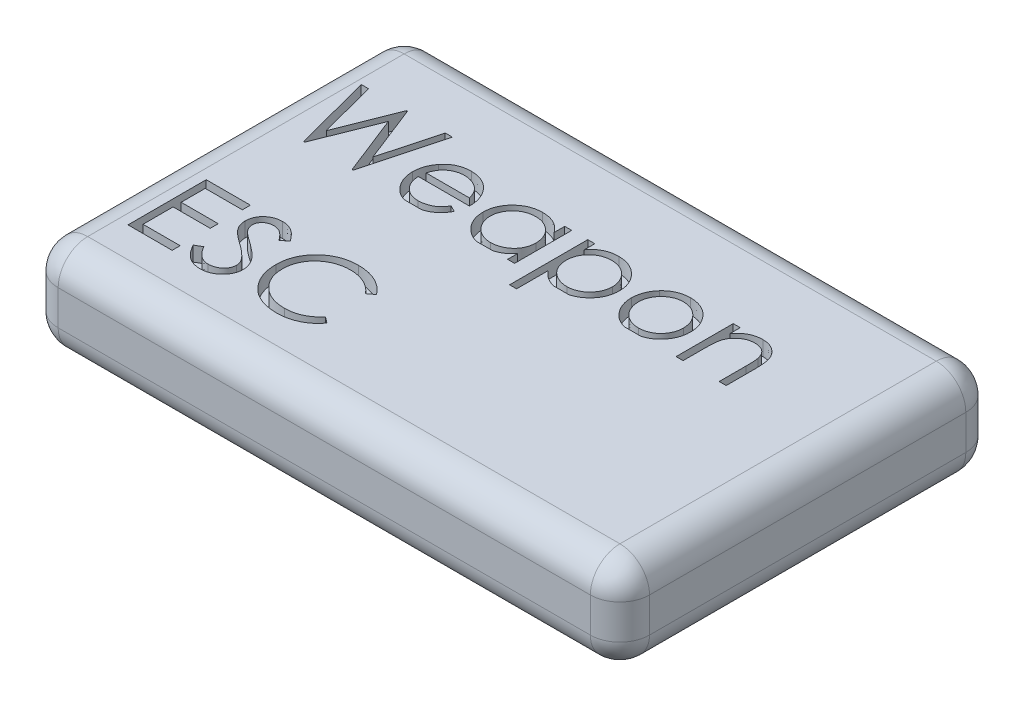
from build123d import *

# Parameters (mm, degrees)
SKETCH1_W           = 20
SKETCH1_H           = 12.7
BOSS_EXTRUDE1_DEPTH = 3.175
FILLET1_R           = 1
CUT_EXTRUDE1_DEPTH  = 0.5


with BuildPart() as part:
    # Sketch1 → Boss-Extrude1 (new body)
    with BuildSketch(Plane(origin=(0, 0, 0), x_dir=(1, 0, 0), z_dir=(0, 1, 0))):
        with Locations((10, 6.35)):
            Rectangle(SKETCH1_W, SKETCH1_H)
    extrude(amount=BOSS_EXTRUDE1_DEPTH)

    # Fillet1
    fillet1_edges = [part.edges().sort_by_distance(p)[0] for p in [
        (0, 0, -6.35),
        (10, 0, 0),
        (20, 0, -6.35),
        (10, 0, -12.7),
        (20, 3.175, -6.35),
        (10, 3.175, -12.7),
        (0, 1.5875, -12.7),
        (20, 1.5875, -12.7),
        (20, 1.5875, 0),
        (0, 1.5875, 0),
        (0, 3.175, -6.35),
        (10, 3.175, 0),
    ]]
    fillet(fillet1_edges, radius=FILLET1_R)

    # Sketch2 → Cut-Extrude1 (cut)
    # profile 1 of 9: a face of its own
    with BuildSketch(Plane(origin=(0, 3.175, 0), x_dir=(1, 0, 0), z_dir=(0, 1, 0))):
        Polygon((1.169604701, 10.078154517), (1.873464209, 7.432321183), (1.90738515, 7.432321183), (2.713007479, 9.45591727), (3.509089543, 7.432321183), (3.543010483, 7.432321183), (4.256410256, 10.078154517), (4.013663528, 10.078154517), (3.493189103, 8.151021103), (2.737388154, 10.078154517), (2.7029372, 10.078154517), (1.932825855, 8.137770736), (1.415001502, 10.078154517), align=None)
    # profile 2 of 9: a face of its own
    with BuildSketch(Plane(origin=(0, 3.175, 0), x_dir=(1, 0, 0), z_dir=(0, 1, 0))):
        with BuildLine():
            Line((14.466613248, 9.365814773), (14.466613248, 7.432321183))
            Line((14.466613248, 7.432321183), (14.704059829, 7.432321183))
            Line((14.704059829, 7.432321183), (14.704059829, 8.13141056))
            add(Edge.make_bspline(
                [(14.740630843, 8.650294941), (14.733558671, 8.622024009), (14.725668191, 8.575551441), (14.717826942, 8.508343896), (14.712486754, 8.447197589), (14.70923674, 8.378587746), (14.704283581, 8.272633885), (14.704413929, 8.18934941), (14.704059829, 8.13141056)],
                knots=[0, 0, 0, 0, 0.167615077, 0.271052394, 0.389459503, 0.520842802, 0.666398759, 1, 1, 1, 1], degree=3))
            add(Edge.make_bspline(
                [(15.398379073, 9.162289132), (15.360600247, 9.162469918), (15.304105063, 9.15816489), (15.231051749, 9.142372411), (15.177817866, 9.126614736), (15.12678507, 9.104942559), (15.076314475, 9.080353222), (15.028306384, 9.049700341), (14.981737126, 9.015538489), (14.938411467, 8.977680942), (14.898097439, 8.937733104), (14.862162217, 8.895191102), (14.829599732, 8.850742332), (14.80151176, 8.803769233), (14.768611554, 8.738203917), (14.750147755, 8.686018868), (14.740630843, 8.650294941)],
                knots=[0, 0, 0, 0, 0.126626858, 0.188984372, 0.250230194, 0.312351163, 0.374573618, 0.438147531, 0.502920413, 0.567974095, 0.630771334, 0.692934609, 0.754397534, 0.815218352, 0.876116925, 1, 1, 1, 1], degree=3))
            add(Edge.make_bspline(
                [(15.897122897, 8.781738584), (15.883876871, 8.839800748), (15.853883712, 8.922670919), (15.787158805, 9.014577688), (15.728309366, 9.069154339), (15.659336716, 9.111578994), (15.550161552, 9.152569693), (15.460103618, 9.162639998), (15.398379073, 9.162289132)],
                knots=[0, 0, 0, 0, 0.260833163, 0.378476029, 0.493177646, 0.609280965, 0.729981038, 1, 1, 1, 1], degree=3))
            add(Edge.make_bspline(
                [(15.925213675, 8.341826392), (15.924839802, 8.392175125), (15.924755613, 8.464286329), (15.921782966, 8.555978029), (15.918801593, 8.614487716), (15.914418668, 8.666066083), (15.90886111, 8.721247984), (15.902461912, 8.759017736), (15.897122897, 8.781738584)],
                knots=[0, 0, 0, 0, 0.342109649, 0.489825663, 0.623254428, 0.740079676, 0.841482673, 1, 1, 1, 1], degree=3))
            Line((15.925213675, 8.341826392), (15.925213675, 7.432321183))
            Line((15.925213675, 7.432321183), (16.162660256, 7.432321183))
            Line((16.162660256, 7.432321183), (16.162660256, 8.419738551))
            add(Edge.make_bspline(
                [(15.439720219, 9.399735713), (15.509551808, 9.39927324), (15.613779605, 9.387932084), (15.742723763, 9.340494706), (15.830878741, 9.292750656), (15.910350927, 9.233316994), (15.980143852, 9.164091415), (16.037870896, 9.084461584), (16.076573667, 9.010587722), (16.102068609, 8.945055094), (16.118119402, 8.888928093), (16.13174929, 8.826397107), (16.143569038, 8.757651109), (16.151552625, 8.682208429), (16.160346443, 8.569022266), (16.163249863, 8.480733856), (16.162660256, 8.419738551)],
                knots=[0, 0, 0, 0, 0.15117814, 0.223487984, 0.295542644, 0.366976255, 0.437130525, 0.507043616, 0.578559734, 0.616613545, 0.658756237, 0.704491226, 0.754803115, 0.809331625, 0.868274455, 1, 1, 1, 1], degree=3))
            add(Edge.make_bspline(
                [(14.704059829, 9.017065107), (14.751954556, 9.079209882), (14.828226204, 9.166084386), (14.947151906, 9.257222624), (15.037845438, 9.310241677), (15.132814589, 9.350149343), (15.26548569, 9.389149379), (15.369832665, 9.399375698), (15.439720219, 9.399735713)],
                knots=[0, 0, 0, 0, 0.273568781, 0.398988314, 0.519929781, 0.638110022, 0.756588901, 1, 1, 1, 1], degree=3))
            Line((14.704059829, 9.017065107), (14.704059829, 9.365814773))
            Line((14.704059829, 9.365814773), (14.466613248, 9.365814773))
        make_face()
    # profile 3 of 9: a face of its own
    with BuildSketch(Plane(origin=(0, 3.175, 0), x_dir=(1, 0, 0), z_dir=(0, 1, 0))):
        with BuildLine():
            add(Edge.make_bspline(
                [(12.712144434, 7.432321183), (12.702602512, 7.434820118), (12.661487393, 7.446283654), (12.590573573, 7.471506899), (12.502017329, 7.513314324), (12.419024046, 7.565179521), (12.341009816, 7.626079698), (12.269139873, 7.695729931), (12.20412923, 7.771332736), (12.146772097, 7.850821146), (12.09847678, 7.933529974), (12.0588865, 8.019619842), (12.028056775, 8.1087155), (11.998853126, 8.232985597), (11.990001418, 8.329082939), (11.990384615, 8.393767831)],
                knots=[0.179537829, 0.179537829, 0.179537829, 0.179537829, 0.198324187, 0.260825013, 0.322713588, 0.384554535, 0.446912858, 0.510957633, 0.574930701, 0.636684538, 0.697483115, 0.757133808, 0.816965664, 0.876818352, 1, 1, 1, 1], degree=3))
            Line((12.712144434, 7.432321183), (13.270991006, 7.432321183))
            add(Edge.make_bspline(
                [(13.991720085, 8.393767831), (13.992103285, 8.329082936), (13.983251572, 8.232985601), (13.95404793, 8.108715493), (13.923218185, 8.019619865), (13.883627978, 7.933529889), (13.835332387, 7.850821472), (13.777976305, 7.771331479), (13.712961587, 7.69573481), (13.641106845, 7.626061693), (13.56315594, 7.565336794), (13.480640762, 7.513313024), (13.392463653, 7.471398151), (13.321669585, 7.446276017), (13.280542351, 7.434820827), (13.270991006, 7.432321183)],
                knots=[0, 0, 0, 0, 0.123336979, 0.18326514, 0.243172443, 0.302898354, 0.363773598, 0.425605305, 0.489659043, 0.553784577, 0.616221533, 0.677854471, 0.739516897, 0.802096536, 0.820924402, 0.820924402, 0.820924402, 0.820924402], degree=3))
            add(Edge.make_bspline(
                [(13.72671274, 9.081196884), (13.769825468, 9.034072385), (13.827575742, 8.958523683), (13.889744812, 8.8493938), (13.926865155, 8.764561953), (13.956076795, 8.676583307), (13.984192162, 8.553408955), (13.99136147, 8.457976043), (13.991720085, 8.393767831)],
                knots=[0, 0, 0, 0, 0.253834363, 0.376505623, 0.498533686, 0.621367729, 0.744564745, 1, 1, 1, 1], degree=3))
            add(Edge.make_bspline(
                [(12.99211238, 9.399735713), (13.063240061, 9.400472495), (13.168488418, 9.390217486), (13.303142533, 9.356468769), (13.398238253, 9.322295252), (13.487727627, 9.276387615), (13.602907554, 9.202647234), (13.679723886, 9.132553723), (13.72671274, 9.081196884)],
                knots=[0, 0, 0, 0, 0.258332351, 0.382133976, 0.503804392, 0.624692987, 0.74687059, 1, 1, 1, 1], degree=3))
            add(Edge.make_bspline(
                [(12.25539196, 9.07960684), (12.301972755, 9.131650244), (12.379473347, 9.201077753), (12.494379792, 9.276310446), (12.584853185, 9.32131333), (12.679872378, 9.356670471), (12.815073419, 9.390194033), (12.920623999, 9.400388369), (12.99211238, 9.399735713)],
                knots=[0, 0, 0, 0, 0.252712986, 0.374819133, 0.496436426, 0.617910557, 0.741287617, 1, 1, 1, 1], degree=3))
            add(Edge.make_bspline(
                [(11.990384615, 8.393767831), (11.990758258, 8.457802136), (11.9979758, 8.553046326), (12.025955779, 8.675896819), (12.055204118, 8.763534905), (12.092660312, 8.847998769), (12.154009835, 8.957425104), (12.212746192, 9.032351578), (12.25539196, 9.07960684)],
                knots=[0, 0, 0, 0, 0.255237725, 0.378678596, 0.501087887, 0.622713679, 0.746240795, 1, 1, 1, 1], degree=3))
        make_face()
        with BuildLine():
            add(Edge.make_bspline(
                [(12.99105235, 9.162289132), (12.940416909, 9.162154053), (12.865162406, 9.155316907), (12.768426838, 9.131803729), (12.699302166, 9.107182404), (12.633055593, 9.075350674), (12.569624097, 9.036263511), (12.508821007, 8.990427359), (12.45183572, 8.937917033), (12.399537326, 8.88055609), (12.35381835, 8.819438581), (12.314945247, 8.755555841), (12.2825534, 8.688841236), (12.258458396, 8.618619509), (12.234691255, 8.520201636), (12.227973222, 8.443678193), (12.227831197, 8.392177787)],
                knots=[0, 0, 0, 0, 0.126043628, 0.187165358, 0.24739929, 0.308380031, 0.369779617, 0.432583925, 0.497640786, 0.562401137, 0.625557103, 0.687332005, 0.748312746, 0.809791039, 0.871767572, 1, 1, 1, 1], degree=3))
            add(Edge.make_bspline(
                [(13.754273504, 8.392177787), (13.754135216, 8.443680536), (13.747406275, 8.520197138), (13.72365664, 8.618625991), (13.699512994, 8.68881721), (13.667261841, 8.755728574), (13.627639081, 8.819251014), (13.582106787, 8.880767808), (13.529177317, 8.937731606), (13.472251516, 8.990447837), (13.411423773, 9.036281257), (13.34808637, 9.075178987), (13.282032129, 9.107454217), (13.212899063, 9.13158079), (13.116466481, 9.155479429), (13.04148293, 9.162024198), (12.99105235, 9.162289132)],
                knots=[0, 0, 0, 0, 0.128273727, 0.19027022, 0.251768314, 0.312768695, 0.374793279, 0.437969586, 0.5030474, 0.568125214, 0.630949749, 0.692369109, 0.752973168, 0.813641067, 0.874355209, 1, 1, 1, 1], degree=3))
            add(Edge.make_bspline(
                [(12.99105235, 7.635846824), (13.058532582, 7.635171522), (13.158767738, 7.647549464), (13.285779483, 7.688593328), (13.375156687, 7.730814506), (13.457983625, 7.784510739), (13.533087708, 7.848336868), (13.597906216, 7.923489909), (13.653355783, 8.007066309), (13.698322034, 8.097237972), (13.742211068, 8.224400191), (13.754155656, 8.325108514), (13.754273504, 8.392177787)],
                knots=[0, 0, 0, 0, 0.168983264, 0.250907582, 0.333708096, 0.416004984, 0.497659568, 0.579893286, 0.663902321, 0.748466254, 0.831790886, 1, 1, 1, 1], degree=3))
            add(Edge.make_bspline(
                [(12.227831197, 8.392177787), (12.227996992, 8.32513087), (12.239799272, 8.224356193), (12.283897829, 8.09737784), (12.328139757, 8.006955577), (12.383643984, 7.923292332), (12.449020773, 7.848700482), (12.523588586, 7.784307904), (12.606453109, 7.73086193), (12.69592376, 7.688462797), (12.823225603, 7.647737473), (12.923542682, 7.635085143), (12.99105235, 7.635846824)],
                knots=[0, 0, 0, 0, 0.168178654, 0.251488198, 0.335840671, 0.419834494, 0.502344876, 0.58364902, 0.665931005, 0.748716525, 0.831047336, 1, 1, 1, 1], degree=3))
        make_face(mode=Mode.SUBTRACT)
    # profile 4 of 9: a face of its own
    with BuildSketch(Plane(origin=(0, 3.175, 0), x_dir=(1, 0, 0), z_dir=(0, 1, 0))):
        with BuildLine():
            Line((9.548076923, 9.365814773), (9.548076923, 6.71998144))
            Line((9.548076923, 6.71998144), (9.785523504, 6.71998144))
            Line((9.785523504, 6.71998144), (9.785523504, 7.782660893))
            add(Edge.make_bspline(
                [(10.309139651, 7.432321183), (10.286824521, 7.438215017), (10.229663629, 7.455480196), (10.140646746, 7.493035323), (10.043784805, 7.547692184), (9.919004992, 7.638028574), (9.836581533, 7.722079417), (9.785523504, 7.782660893)],
                knots=[0.295016817, 0.295016817, 0.295016817, 0.295016817, 0.371230204, 0.49211577, 0.613400988, 0.73799732, 1, 1, 1, 1], degree=3))
            Line((10.309139651, 7.432321183), (10.84371721, 7.432321183))
            add(Edge.make_bspline(
                [(11.583333333, 8.404368125), (11.583179694, 8.336703394), (11.574470508, 8.236398186), (11.543737741, 8.107341464), (11.511220598, 8.015662082), (11.469149491, 7.927983843), (11.417970446, 7.844370705), (11.357579428, 7.764849278), (11.288560303, 7.690499124), (11.213680956, 7.622010533), (11.133642613, 7.562109693), (11.049687408, 7.51180988), (10.962244546, 7.469783372), (10.892613281, 7.445754471), (10.852665682, 7.434671204), (10.84371721, 7.432321183)],
                knots=[0, 0, 0, 0, 0.128034164, 0.189573725, 0.250579835, 0.311733221, 0.37325008, 0.435762516, 0.500345561, 0.564949367, 0.627527909, 0.68915729, 0.749865012, 0.8107602, 0.828257924, 0.828257924, 0.828257924, 0.828257924], degree=3))
            add(Edge.make_bspline(
                [(10.566765158, 9.399735713), (10.634523234, 9.399056776), (10.735279303, 9.391527687), (10.864875314, 9.360709005), (10.956773692, 9.327925237), (11.045419327, 9.287357516), (11.129497848, 9.236168489), (11.210319419, 9.176896638), (11.285851338, 9.108685566), (11.355641732, 9.034883215), (11.416002238, 8.955491339), (11.46806397, 8.8731209), (11.51015594, 8.786494406), (11.543092323, 8.696295982), (11.574822845, 8.569488388), (11.582945473, 8.47075633), (11.583333333, 8.404368125)],
                knots=[0, 0, 0, 0, 0.128636051, 0.190652902, 0.252125037, 0.313446276, 0.375227279, 0.438498083, 0.5032851, 0.568009687, 0.630878982, 0.692153504, 0.75255215, 0.813191094, 0.8739854, 1, 1, 1, 1], degree=3))
            add(Edge.make_bspline(
                [(9.785523504, 9.008054857), (9.832517462, 9.072544737), (9.911459824, 9.160185002), (10.033378372, 9.254052547), (10.129471841, 9.308049897), (10.231096944, 9.348692737), (10.375661619, 9.389626955), (10.48986918, 9.399492715), (10.566765158, 9.399735713)],
                knots=[0, 0, 0, 0, 0.263044683, 0.386061082, 0.505770653, 0.625178031, 0.746147722, 1, 1, 1, 1], degree=3))
            Line((9.785523504, 9.008054857), (9.785523504, 9.365814773))
            Line((9.785523504, 9.365814773), (9.548076923, 9.365814773))
        make_face()
        with BuildLine():
            add(Edge.make_bspline(
                [(10.564645099, 9.162289132), (10.511648566, 9.163069991), (10.43346287, 9.15545716), (10.332421594, 9.133073397), (10.261269021, 9.10822714), (10.193044081, 9.077678682), (10.128270869, 9.039519066), (10.066995234, 8.994424335), (10.009371188, 8.943262153), (9.957313952, 8.886887194), (9.911228399, 8.826722605), (9.872519882, 8.76284455), (9.840383836, 8.695847886), (9.81595846, 8.625208117), (9.792362764, 8.525292938), (9.785672459, 8.447387225), (9.785523504, 8.394827861)],
                knots=[0, 0, 0, 0, 0.130023749, 0.192374057, 0.253884304, 0.314896085, 0.375805828, 0.438242236, 0.501591268, 0.56488076, 0.626533341, 0.687515765, 0.748105916, 0.808795537, 0.870821519, 1, 1, 1, 1], degree=3))
            add(Edge.make_bspline(
                [(11.345886752, 8.401718052), (11.346817733, 8.467879241), (11.331999718, 8.566849059), (11.288531545, 8.693418546), (11.241308701, 8.783772985), (11.185197526, 8.869023909), (11.117357889, 8.944282916), (11.041295685, 9.010176639), (10.956107869, 9.064628588), (10.864684532, 9.107889783), (10.735396255, 9.150638224), (10.633059866, 9.16199055), (10.564645099, 9.162289132)],
                knots=[0, 0, 0, 0, 0.163349297, 0.245826474, 0.33036716, 0.415198374, 0.497940932, 0.580476126, 0.663740011, 0.747512837, 0.830398741, 1, 1, 1, 1], degree=3))
            add(Edge.make_bspline(
                [(10.568355202, 7.635846824), (10.635242483, 7.635441413), (10.735159151, 7.648970077), (10.862858048, 7.690494395), (10.953709978, 7.735459991), (11.038998553, 7.790652791), (11.116017129, 7.856839866), (11.1832988, 7.933562349), (11.240661225, 8.018991891), (11.286827072, 8.110591808), (11.3331314, 8.236400124), (11.345127243, 8.3360851), (11.345886752, 8.401718052)],
                knots=[0, 0, 0, 0, 0.165573796, 0.248158777, 0.332033307, 0.416257349, 0.49952535, 0.58303856, 0.668595904, 0.75403535, 0.8369197, 1, 1, 1, 1], degree=3))
            add(Edge.make_bspline(
                [(9.785523504, 8.394827861), (9.7856499, 8.326204868), (9.797088246, 8.224081286), (9.839442573, 8.095694713), (9.883643571, 8.006901208), (9.939556109, 7.925271164), (10.006906936, 7.85217688), (10.0851054, 7.788082641), (10.17284659, 7.734078241), (10.266903258, 7.69029228), (10.397797879, 7.648179527), (10.500220186, 7.635975007), (10.568355202, 7.635846824)],
                knots=[0, 0, 0, 0, 0.169344011, 0.251060671, 0.332326431, 0.413189279, 0.494299499, 0.57665388, 0.661784919, 0.74776493, 0.831967435, 1, 1, 1, 1], degree=3))
        make_face(mode=Mode.SUBTRACT)
    # profile 5 of 9: a face of its own
    with BuildSketch(Plane(origin=(0, 3.175, 0), x_dir=(1, 0, 0), z_dir=(0, 1, 0))):
        with BuildLine():
            add(Edge.make_bspline(
                [(7.709182374, 7.432321183), (7.700230275, 7.434671071), (7.660278507, 7.445750285), (7.590644343, 7.46978449), (7.503201536, 7.511809687), (7.419245436, 7.562109321), (7.339210722, 7.62201227), (7.264317311, 7.690492324), (7.195350443, 7.764874295), (7.134827282, 7.844208129), (7.0843675, 7.92815079), (7.042161408, 8.015639674), (7.009690951, 8.107347486), (6.978941396, 8.236393985), (6.970242702, 8.336705582), (6.97008547, 8.404368125)],
                knots=[0.171490765, 0.171490765, 0.171490765, 0.171490765, 0.189004127, 0.249930071, 0.310668454, 0.372328961, 0.43493911, 0.499575544, 0.564191208, 0.626735217, 0.688109334, 0.749293607, 0.810330528, 0.87190117, 1, 1, 1, 1], degree=3))
            Line((7.709182374, 7.432321183), (8.254199087, 7.432321183))
            add(Edge.make_bspline(
                [(8.767895299, 7.766760453), (8.717066909, 7.706699131), (8.635037797, 7.623144112), (8.509075274, 7.53648614), (8.411809694, 7.484936906), (8.325920279, 7.452393426), (8.272752076, 7.437107324), (8.254199087, 7.432321183)],
                knots=[0, 0, 0, 0, 0.262084975, 0.386269912, 0.507164597, 0.627300236, 0.69099225, 0.69099225, 0.69099225, 0.69099225], degree=3))
            Line((8.767895299, 7.766760453), (8.767895299, 7.432321183))
            Line((8.767895299, 7.432321183), (9.00534188, 7.432321183))
            Line((9.00534188, 7.432321183), (9.00534188, 9.365814773))
            Line((9.00534188, 9.365814773), (8.767895299, 9.365814773))
            Line((8.767895299, 9.365814773), (8.767895299, 9.008054857))
            add(Edge.make_bspline(
                [(7.985593616, 9.399735713), (8.062846419, 9.399509706), (8.177557151, 9.389591562), (8.322698327, 9.348786058), (8.4244972, 9.308069228), (8.520606377, 9.253874385), (8.643012455, 9.160775719), (8.721079203, 9.072278963), (8.767895299, 9.008054857)],
                knots=[0, 0, 0, 0, 0.254653531, 0.376014554, 0.495255252, 0.614797719, 0.738105554, 1, 1, 1, 1], degree=3))
            add(Edge.make_bspline(
                [(6.97008547, 8.404368125), (6.970476792, 8.470754173), (6.978589276, 8.569492553), (7.010336124, 8.69628997), (7.043226831, 8.786516867), (7.085448545, 8.872952839), (7.136796807, 8.955656982), (7.197288049, 9.034857673), (7.267026312, 9.108692502), (7.342572277, 9.176894846), (7.423390199, 9.236168877), (7.507469623, 9.287357685), (7.596115181, 9.327924187), (7.688012971, 9.360713066), (7.81744157, 9.391464819), (7.918001471, 9.399132749), (7.985593616, 9.399735713)],
                knots=[0, 0, 0, 0, 0.12607881, 0.186904093, 0.247573935, 0.308003356, 0.369131898, 0.432033228, 0.496790794, 0.561610823, 0.624913866, 0.686726349, 0.748078833, 0.809582291, 0.871630743, 1, 1, 1, 1], degree=3))
        make_face()
        with BuildLine():
            add(Edge.make_bspline(
                [(7.988773705, 9.162289132), (7.92035925, 9.161990351), (7.818021942, 9.15063861), (7.688735162, 9.107889216), (7.597307561, 9.064630734), (7.512135574, 9.010168714), (7.436014824, 8.94431224), (7.36832955, 8.868839239), (7.311381807, 8.784096131), (7.265041097, 8.693245235), (7.221301324, 8.566912736), (7.206660007, 8.467847372), (7.207532051, 8.401718052)],
                knots=[0, 0, 0, 0, 0.169593435, 0.252475515, 0.336244477, 0.419504521, 0.502035907, 0.584774648, 0.669846475, 0.754184866, 0.836658238, 1, 1, 1, 1], degree=3))
            add(Edge.make_bspline(
                [(8.767895299, 8.394827861), (8.767746516, 8.44738738), (8.761055711, 8.525292642), (8.737460812, 8.625208537), (8.713033256, 8.695846346), (8.680905325, 8.762850307), (8.642166221, 8.826700861), (8.596124118, 8.887066082), (8.543523048, 8.943114758), (8.485945742, 8.994236966), (8.425020131, 9.039870107), (8.360024236, 9.077354483), (8.292051441, 9.108388518), (8.220982581, 9.133043936), (8.119966187, 9.155477809), (8.041764877, 9.163059196), (7.988773705, 9.162289132)],
                knots=[0, 0, 0, 0, 0.129188088, 0.191218683, 0.251912818, 0.312507474, 0.373494434, 0.4351516, 0.498741474, 0.562095217, 0.624186567, 0.685475718, 0.746096815, 0.807611636, 0.869966581, 1, 1, 1, 1], degree=3))
            add(Edge.make_bspline(
                [(7.986653646, 7.635846824), (8.0549255, 7.636139726), (8.157451222, 7.647950328), (8.288104799, 7.690321292), (8.381680876, 7.734043145), (8.46885449, 7.788300801), (8.547094653, 7.85180298), (8.613249744, 7.925662568), (8.669346414, 8.006834607), (8.713284384, 8.095816402), (8.756777474, 8.223867177), (8.767531126, 8.326287717), (8.767895299, 8.394827861)],
                knots=[0, 0, 0, 0, 0.16866354, 0.252551924, 0.338239689, 0.423102661, 0.505556051, 0.586175656, 0.66713572, 0.74849918, 0.830452399, 1, 1, 1, 1], degree=3))
            add(Edge.make_bspline(
                [(7.207532051, 8.401718052), (7.208097498, 8.336019196), (7.22067005, 8.236592179), (7.265944735, 8.110498107), (7.312190403, 8.018832196), (7.370175476, 7.933723815), (7.437367488, 7.856812158), (7.514438048, 7.790678211), (7.599805393, 7.735298832), (7.690980151, 7.690631553), (7.819090261, 7.648772777), (7.919447653, 7.635529576), (7.986653646, 7.635846824)],
                knots=[0, 0, 0, 0, 0.162858895, 0.245483689, 0.330807139, 0.416493374, 0.499893203, 0.583048156, 0.667157852, 0.751311929, 0.833784789, 1, 1, 1, 1], degree=3))
        make_face(mode=Mode.SUBTRACT)
    # profile 6 of 9: a face of its own
    with BuildSketch(Plane(origin=(0, 3.175, 0), x_dir=(1, 0, 0), z_dir=(0, 1, 0))):
        with BuildLine():
            add(Edge.make_bspline(
                [(5.285616135, 7.432321183), (5.274815642, 7.435135721), (5.232393476, 7.446982597), (5.160636779, 7.472564611), (5.073896778, 7.515984722), (4.993387287, 7.568868692), (4.918684416, 7.630957326), (4.852142278, 7.702785081), (4.7922378, 7.779651834), (4.739376757, 7.859749449), (4.695187365, 7.942876329), (4.659233832, 8.028503761), (4.630223859, 8.1160902), (4.602948126, 8.2373806), (4.596311148, 8.331006669), (4.595619658, 8.393767831)],
                knots=[0.183293708, 0.183293708, 0.183293708, 0.183293708, 0.204796697, 0.268134963, 0.329813747, 0.391301398, 0.453433515, 0.51655169, 0.579631271, 0.641118921, 0.701294047, 0.760810336, 0.819931722, 0.878919575, 1, 1, 1, 1], degree=3))
            Line((5.285616135, 7.432321183), (5.854875214, 7.432321183))
            add(Edge.make_bspline(
                [(6.461271368, 7.932125036), (6.429898712, 7.873393104), (6.377381951, 7.790997405), (6.296535955, 7.692903395), (6.232224824, 7.631106995), (6.164432824, 7.577247694), (6.092821011, 7.530121988), (6.017007064, 7.489968759), (5.937643588, 7.456408341), (5.882660699, 7.439500899), (5.854875214, 7.432321183)],
                knots=[0, 0, 0, 0, 0.181660766, 0.265874227, 0.346354784, 0.424599862, 0.501903184, 0.579992091, 0.658443431, 0.736737234, 0.736737234, 0.736737234, 0.736737234], degree=3))
            Line((6.461271368, 7.932125036), (6.250325521, 8.042898106))
            add(Edge.make_bspline(
                [(5.538515792, 7.635846824), (5.585531422, 7.635619411), (5.656058931, 7.641155296), (5.748170438, 7.660446885), (5.81564731, 7.679994511), (5.880334769, 7.703871441), (5.940240894, 7.732673614), (5.995333905, 7.764537871), (6.046830605, 7.800979581), (6.096762651, 7.845596893), (6.167442527, 7.924835014), (6.218178853, 7.992591377), (6.250325521, 8.042898106)],
                knots=[0, 0, 0, 0, 0.163878894, 0.24565874, 0.327725695, 0.408609961, 0.485749086, 0.559169056, 0.630268476, 0.705306028, 0.792064966, 1, 1, 1, 1], degree=3))
            add(Edge.make_bspline(
                [(4.833066239, 8.348186568), (4.83441843, 8.298107738), (4.841131549, 8.224133067), (4.864022188, 8.129477781), (4.887642499, 8.063647498), (4.916272618, 8.00095618), (4.951336787, 7.941869424), (4.993171186, 7.88665623), (5.039832784, 7.834822702), (5.091772103, 7.788663817), (5.146414404, 7.747349157), (5.204542306, 7.712724213), (5.265697306, 7.684610902), (5.329781109, 7.662634557), (5.420481837, 7.642173602), (5.49088236, 7.63558248), (5.538515792, 7.635846824)],
                knots=[0, 0, 0, 0, 0.134475588, 0.198391058, 0.260753477, 0.321829223, 0.383037238, 0.444653123, 0.507398011, 0.569825238, 0.630777641, 0.690928687, 0.750945133, 0.811049477, 0.872330853, 1, 1, 1, 1], degree=3))
            Line((4.833066239, 8.348186568), (6.563034188, 8.348186568))
            add(Edge.make_bspline(
                [(6.352618356, 9.019185166), (6.38730648, 8.974668019), (6.432594861, 8.902369366), (6.480681573, 8.798965647), (6.509692589, 8.716656241), (6.533134773, 8.630608941), (6.556268038, 8.507875446), (6.561832628, 8.412638797), (6.563034188, 8.348186568)],
                knots=[0, 0, 0, 0, 0.236254763, 0.356174434, 0.477249655, 0.601539871, 0.729618382, 1, 1, 1, 1], degree=3))
            add(Edge.make_bspline(
                [(5.574026776, 9.399735713), (5.651759471, 9.400062265), (5.766594883, 9.388813538), (5.912186067, 9.348529402), (6.013366019, 9.306887288), (6.108366185, 9.253054598), (6.228014681, 9.163042755), (6.306212599, 9.08016037), (6.352618356, 9.019185166)],
                knots=[0, 0, 0, 0, 0.259032841, 0.381879824, 0.502258444, 0.62275219, 0.744742632, 1, 1, 1, 1], degree=3))
            add(Edge.make_bspline(
                [(4.818225828, 9.039325724), (4.864016177, 9.096569877), (4.938680063, 9.176611503), (5.055597285, 9.260342699), (5.147503725, 9.311777355), (5.246035643, 9.350809089), (5.387055556, 9.390492358), (5.498842617, 9.398829644), (5.574026776, 9.399735713)],
                knots=[0, 0, 0, 0, 0.253589335, 0.374643257, 0.495340042, 0.616324775, 0.739759335, 1, 1, 1, 1], degree=3))
            add(Edge.make_bspline(
                [(4.595619658, 8.393767831), (4.596340299, 8.452576166), (4.601840669, 8.540364054), (4.625749462, 8.654167931), (4.65005139, 8.736481841), (4.681483211, 8.816265244), (4.733018583, 8.920217039), (4.782279338, 8.992840833), (4.818225828, 9.039325724)],
                knots=[0, 0, 0, 0, 0.2537679, 0.377428427, 0.500550841, 0.623295883, 0.746578332, 1, 1, 1, 1], degree=3))
        make_face()
        with BuildLine():
            Line((6.325587607, 8.585633149), (4.85797693, 8.585633149))
            add(Edge.make_bspline(
                [(5.088003305, 8.981024108), (5.061635173, 8.958812326), (5.025949402, 8.920347829), (4.983064605, 8.863818262), (4.953308274, 8.816180635), (4.92604993, 8.764298417), (4.891111148, 8.688234605), (4.870400407, 8.627461387), (4.85797693, 8.585633149)],
                knots=[0, 0, 0, 0, 0.222580497, 0.338499871, 0.458708565, 0.585535346, 0.717517743, 1, 1, 1, 1], degree=3))
            add(Edge.make_bspline(
                [(5.586217114, 9.162289132), (5.539404492, 9.16240414), (5.469831252, 9.157341751), (5.380370209, 9.137892876), (5.316335126, 9.118286747), (5.255399087, 9.092110709), (5.176008948, 9.05097512), (5.122411891, 9.009970291), (5.088003305, 8.981024108)],
                knots=[0, 0, 0, 0, 0.259141276, 0.384161763, 0.505991952, 0.629098089, 0.750669123, 1, 1, 1, 1], degree=3))
            add(Edge.make_bspline(
                [(6.325587607, 8.585633149), (6.310563961, 8.646669511), (6.280616623, 8.732788562), (6.225831706, 8.836285953), (6.179275839, 8.900986823), (6.126489187, 8.958439932), (6.065527225, 9.008650485), (5.99716134, 9.053564001), (5.921748784, 9.091489264), (5.841886865, 9.123713615), (5.730151448, 9.152867616), (5.644003932, 9.163151671), (5.586217114, 9.162289132)],
                knots=[0, 0, 0, 0, 0.185231261, 0.267500523, 0.344400382, 0.419594869, 0.496890627, 0.576637919, 0.660267852, 0.745386615, 0.830040327, 1, 1, 1, 1], degree=3))
        make_face(mode=Mode.SUBTRACT)
    # profile 7 of 9: a face of its own
    with BuildSketch(Plane(origin=(0, 3.175, 0), x_dir=(1, 0, 0), z_dir=(0, 1, 0))):
        Polygon((2.831730769, 4.668432294), (1.339209402, 4.668432294), (1.339209402, 2.022598961), (2.831730769, 2.022598961), (2.831730769, 2.293966482), (1.576655983, 2.293966482), (1.576655983, 3.311594688), (2.831730769, 3.311594688), (2.831730769, 3.582962209), (1.576655983, 3.582962209), (1.576655983, 4.397064773), (2.831730769, 4.397064773), align=None)
    # profile 8 of 9: a face of its own
    with BuildSketch(Plane(origin=(0, 3.175, 0), x_dir=(1, 0, 0), z_dir=(0, 1, 0))):
        with BuildLine():
            Line((3.25892261, 2.667096824), (3.03525641, 2.533003108))
            add(Edge.make_bspline(
                [(3.83981871, 1.954757081), (3.800069132, 1.954519251), (3.741094328, 1.959322434), (3.663816765, 1.972322847), (3.6081672, 1.9875533), (3.553710527, 2.006062091), (3.500682509, 2.028843787), (3.449057739, 2.056147066), (3.398546816, 2.087364026), (3.349278277, 2.123693439), (3.301714027, 2.166006661), (3.254294269, 2.213137167), (3.208415396, 2.26636311), (3.163162559, 2.324831399), (3.103146964, 2.412866306), (3.061845037, 2.483714954), (3.03525641, 2.533003108)],
                knots=[0, 0, 0, 0, 0.11369606, 0.169177916, 0.224159217, 0.278719878, 0.333794217, 0.389241459, 0.445822073, 0.503704281, 0.564293892, 0.627975416, 0.69503826, 0.765372726, 0.839611443, 1, 1, 1, 1], degree=3))
            add(Edge.make_bspline(
                [(4.595619658, 2.670806927), (4.596353659, 2.623775889), (4.588675566, 2.554160359), (4.566231677, 2.464121511), (4.541291883, 2.399931729), (4.51080005, 2.337380908), (4.4721234, 2.27810819), (4.427288893, 2.220802193), (4.375858809, 2.166990821), (4.3195812, 2.117592345), (4.260100075, 2.073649054), (4.197318067, 2.037011089), (4.1315755, 2.007105968), (4.062858318, 1.983746506), (3.966029502, 1.960728405), (3.890585356, 1.954561196), (3.83981871, 1.954757081)],
                knots=[0, 0, 0, 0, 0.121774528, 0.18091956, 0.240256115, 0.300114444, 0.361145948, 0.423500582, 0.488669361, 0.553954105, 0.617581261, 0.680238427, 0.742187389, 0.804663212, 0.868258989, 1, 1, 1, 1], degree=3))
            add(Edge.make_bspline(
                [(3.972322382, 3.524660593), (4.027997531, 3.484327421), (4.108413884, 3.425190773), (4.207491986, 3.343057634), (4.27209933, 3.285321877), (4.330214089, 3.229737637), (4.381194678, 3.175639424), (4.425555543, 3.12341391), (4.473327595, 3.056457624), (4.522052577, 2.974221914), (4.577252972, 2.842464284), (4.595567096, 2.738891943), (4.595619658, 2.670806927)],
                knots=[0, 0, 0, 0, 0.187773439, 0.272396139, 0.351320997, 0.424334774, 0.491908784, 0.55423322, 0.611267658, 0.716347845, 0.814540086, 1, 1, 1, 1], degree=3))
            add(Edge.make_bspline(
                [(3.616682525, 3.788077894), (3.630280609, 3.775616122), (3.655147457, 3.75514597), (3.694613945, 3.725737888), (3.735019786, 3.695045497), (3.783380684, 3.659459813), (3.863520936, 3.602434743), (3.927048279, 3.556503187), (3.972322382, 3.524660593)],
                knots=[0, 0, 0, 0, 0.124951974, 0.218093899, 0.333502411, 0.468789179, 0.624937586, 1, 1, 1, 1], degree=3))
            add(Edge.make_bspline(
                [(3.442307692, 4.129937369), (3.441401337, 4.101456481), (3.447863859, 4.059185597), (3.462180721, 4.00365923), (3.47903634, 3.962136826), (3.502367074, 3.920191234), (3.545646095, 3.859200581), (3.586911551, 3.816768483), (3.616682525, 3.788077894)],
                knots=[0, 0, 0, 0, 0.214745861, 0.32293856, 0.434116163, 0.553412311, 0.686072985, 1, 1, 1, 1], degree=3))
            add(Edge.make_bspline(
                [(3.830278446, 4.464906653), (3.777686115, 4.465661081), (3.70041907, 4.454413352), (3.608056435, 4.412520848), (3.550173039, 4.369993892), (3.502045065, 4.31954802), (3.455141549, 4.241854418), (3.44238574, 4.174477911), (3.442307692, 4.129937369)],
                knots=[0, 0, 0, 0, 0.275902964, 0.402370856, 0.528413645, 0.650356379, 0.765895086, 1, 1, 1, 1], degree=3))
            add(Edge.make_bspline(
                [(4.347042768, 4.125697252), (4.322445656, 4.158147211), (4.285116128, 4.203642453), (4.235502579, 4.260717306), (4.200318384, 4.296452112), (4.167513537, 4.328731731), (4.13567536, 4.356369698), (4.105260072, 4.379633618), (4.066920361, 4.404465584), (4.018753919, 4.429050341), (3.937635944, 4.457131924), (3.87325497, 4.464646437), (3.830278446, 4.464906653)],
                knots=[0, 0, 0, 0, 0.189629101, 0.274184089, 0.352183161, 0.423198873, 0.488550946, 0.548473346, 0.601440164, 0.701198082, 0.799591802, 1, 1, 1, 1], degree=3))
            Line((4.347042768, 4.125697252), (4.561698718, 4.288411762))
            add(Edge.make_bspline(
                [(3.85677918, 4.736274175), (3.918705021, 4.736373929), (4.011693731, 4.724986213), (4.128980364, 4.683659502), (4.199617517, 4.648786531), (4.254902582, 4.613907231), (4.29706418, 4.582143683), (4.339788213, 4.545573656), (4.383422297, 4.50410422), (4.427214508, 4.457345137), (4.488547112, 4.386344264), (4.532888751, 4.328996107), (4.561698718, 4.288411762)],
                knots=[0, 0, 0, 0, 0.213251813, 0.318830447, 0.426793531, 0.483645951, 0.543603822, 0.60830765, 0.67712676, 0.750685636, 0.828713418, 1, 1, 1, 1], degree=3))
            add(Edge.make_bspline(
                [(3.204861111, 4.118807061), (3.204725593, 4.174172118), (3.215171088, 4.256534331), (3.250403741, 4.360345597), (3.286869933, 4.433166329), (3.333944926, 4.499664406), (3.388405257, 4.560604843), (3.453275275, 4.611832727), (3.524450745, 4.656601753), (3.602353469, 4.691608342), (3.712019735, 4.727251177), (3.799019665, 4.735527144), (3.85677918, 4.736274175)],
                knots=[0, 0, 0, 0, 0.165779888, 0.246280008, 0.327460928, 0.408796954, 0.489715241, 0.571376032, 0.655523321, 0.741019483, 0.826546761, 1, 1, 1, 1], degree=3))
            add(Edge.make_bspline(
                [(3.35273521, 3.715995896), (3.329340231, 3.746284673), (3.296725514, 3.792783839), (3.261871959, 3.859075558), (3.24162794, 3.909336717), (3.224613216, 3.960164877), (3.209210761, 4.029678436), (3.204659272, 4.083113278), (3.204861111, 4.118807061)],
                knots=[0, 0, 0, 0, 0.262558979, 0.388264447, 0.512667355, 0.63372227, 0.75539386, 1, 1, 1, 1], degree=3))
            add(Edge.make_bspline(
                [(3.786287226, 3.356115922), (3.732747566, 3.393583866), (3.657813358, 3.449180912), (3.564244869, 3.521557441), (3.505846465, 3.568646145), (3.455667704, 3.611425927), (3.403511886, 3.658106279), (3.370994383, 3.693434579), (3.35273521, 3.715995896)],
                knots=[0, 0, 0, 0, 0.347081672, 0.495567816, 0.628357302, 0.74551967, 0.845830751, 1, 1, 1, 1], degree=3))
            add(Edge.make_bspline(
                [(4.263300447, 2.934224228), (4.23891471, 2.966390204), (4.19766091, 3.015167672), (4.133648921, 3.07739066), (4.077795856, 3.129606644), (4.014191189, 3.182737491), (3.918292187, 3.261012833), (3.840164665, 3.317292468), (3.786287226, 3.356115922)],
                knots=[0, 0, 0, 0, 0.189529918, 0.299197872, 0.418925887, 0.548376285, 0.68813637, 1, 1, 1, 1], degree=3))
            add(Edge.make_bspline(
                [(4.358173077, 2.67451703), (4.358422063, 2.719347106), (4.340366344, 2.812879656), (4.29214209, 2.894790188), (4.263300447, 2.934224228)],
                knots=[0, 0, 0, 0, 0.477158319, 1, 1, 1, 1], degree=3))
            add(Edge.make_bspline(
                [(3.83981871, 2.226124602), (3.885832976, 2.225709611), (3.954395847, 2.233794203), (4.042464698, 2.259294927), (4.104913445, 2.286338648), (4.163193778, 2.319109653), (4.214301771, 2.358678612), (4.258482406, 2.402982471), (4.294630493, 2.452409333), (4.322334655, 2.505562733), (4.35080778, 2.578176811), (4.357474045, 2.636394633), (4.358173077, 2.67451703)],
                knots=[0, 0, 0, 0, 0.180930311, 0.27008822, 0.360156133, 0.448342532, 0.532665842, 0.613833704, 0.693981527, 0.772715977, 0.849335172, 1, 1, 1, 1], degree=3))
            add(Edge.make_bspline(
                [(3.25892261, 2.667096824), (3.297654052, 2.599859003), (3.358821284, 2.505566997), (3.454974993, 2.398788418), (3.526764985, 2.336110064), (3.601053958, 2.286852972), (3.703103529, 2.240406373), (3.78539148, 2.225981366), (3.83981871, 2.226124602)],
                knots=[0, 0, 0, 0, 0.3046461, 0.438546905, 0.562322299, 0.677432543, 0.786897393, 1, 1, 1, 1], degree=3))
        make_face()
    # profile 9 of 9: a face of its own
    with BuildSketch(Plane(origin=(0, 3.175, 0), x_dir=(1, 0, 0), z_dir=(0, 1, 0))):
        with BuildLine():
            Line((7.372896635, 4.023934431), (7.580662393, 4.182938838))
            add(Edge.make_bspline(
                [(6.426290398, 4.736274175), (6.486448345, 4.736388241), (6.575744027, 4.732302551), (6.692544599, 4.716412782), (6.776916869, 4.700466361), (6.859408454, 4.680650588), (6.939388376, 4.654843283), (7.017326077, 4.625333221), (7.092730001, 4.591346849), (7.165238298, 4.553196347), (7.234828666, 4.511304881), (7.300947292, 4.465723752), (7.364063248, 4.41684283), (7.42310657, 4.3636198), (7.498891995, 4.288675583), (7.548766532, 4.225821985), (7.580662393, 4.182938838)],
                knots=[0, 0, 0, 0, 0.135682946, 0.20121499, 0.265682235, 0.329266835, 0.392395428, 0.455069762, 0.51712685, 0.578790035, 0.639739863, 0.700191504, 0.759806243, 0.819628319, 0.879354791, 1, 1, 1, 1], degree=3))
            add(Edge.make_bspline(
                [(5.00267094, 3.360886054), (5.002623372, 3.454474606), (5.014486682, 3.593191585), (5.057460356, 3.771173637), (5.102315875, 3.896814894), (5.159255287, 4.017110036), (5.229575679, 4.131138745), (5.312479721, 4.239630614), (5.407311858, 4.340939438), (5.511306276, 4.433573134), (5.622672283, 4.515070292), (5.741191914, 4.582889507), (5.865559798, 4.639594108), (5.996705863, 4.683128571), (6.183103914, 4.724656192), (6.328165299, 4.736083531), (6.426290398, 4.736274175)],
                knots=[0, 0, 0, 0, 0.127013532, 0.18795481, 0.248013913, 0.307747682, 0.368234515, 0.429469844, 0.492743437, 0.556257769, 0.618216786, 0.679655476, 0.741245546, 0.803415265, 0.866815462, 1, 1, 1, 1], degree=3))
            add(Edge.make_bspline(
                [(5.338170239, 2.417459905), (5.283338094, 2.481518104), (5.209649997, 2.58416725), (5.131708079, 2.732602599), (5.08451121, 2.848552334), (5.047699376, 2.969533201), (5.012944809, 3.139966109), (5.002407702, 3.271803016), (5.00267094, 3.360886054)],
                knots=[0, 0, 0, 0, 0.247156016, 0.368779749, 0.490733862, 0.613613772, 0.738957576, 1, 1, 1, 1], degree=3))
            add(Edge.make_bspline(
                [(6.429470486, 1.954757081), (6.373178333, 1.954055426), (6.289959926, 1.95856971), (6.180786919, 1.970363013), (6.102337814, 1.983374664), (6.025891504, 1.998759498), (5.952140317, 2.019373842), (5.880358713, 2.042467935), (5.810835005, 2.06961028), (5.743510187, 2.100238674), (5.678600963, 2.134854671), (5.616138813, 2.173168621), (5.555503565, 2.214330762), (5.497613561, 2.259682934), (5.422871056, 2.325180869), (5.370737045, 2.379170352), (5.338170239, 2.417459905)],
                knots=[0, 0, 0, 0, 0.137749562, 0.203916744, 0.268779862, 0.332413706, 0.39475354, 0.456180032, 0.516995649, 0.577395938, 0.637198344, 0.696999184, 0.756756194, 0.816553905, 0.876947997, 1, 1, 1, 1], degree=3))
            add(Edge.make_bspline(
                [(7.580662393, 2.509682461), (7.547927201, 2.466180078), (7.495895455, 2.403679482), (7.419646765, 2.32731302), (7.359443651, 2.274290487), (7.296607113, 2.224283388), (7.230029565, 2.178697394), (7.160580701, 2.136900309), (7.088497324, 2.098628687), (7.013855614, 2.064673506), (6.936745129, 2.035603889), (6.857498184, 2.01056455), (6.77611129, 1.989957676), (6.692415148, 1.973899409), (6.576893549, 1.959297829), (6.488783874, 1.954326083), (6.429470486, 1.954757081)],
                knots=[0, 0, 0, 0, 0.123053062, 0.183475001, 0.243726501, 0.304278917, 0.364862921, 0.425946204, 0.48739123, 0.549220384, 0.611143589, 0.67352853, 0.736961457, 0.800785283, 0.866012596, 1, 1, 1, 1], degree=3))
            Line((7.580662393, 2.509682461), (7.372896635, 2.667096824))
            add(Edge.make_bspline(
                [(6.427880442, 2.226124602), (6.518726419, 2.226099409), (6.653664751, 2.238911925), (6.825942408, 2.285757119), (6.947894378, 2.334004176), (7.063775816, 2.396836237), (7.213133988, 2.499882091), (7.311883416, 2.596920769), (7.372896635, 2.667096824)],
                knots=[0, 0, 0, 0, 0.252948636, 0.374754734, 0.495939754, 0.617180641, 0.740909469, 1, 1, 1, 1], degree=3))
            add(Edge.make_bspline(
                [(5.240117521, 3.342865554), (5.239765337, 3.266059533), (5.250463491, 3.152627753), (5.284973753, 3.006776934), (5.322891541, 2.904435724), (5.369710814, 2.806231324), (5.428853899, 2.713824533), (5.497356535, 2.625819178), (5.576182796, 2.544294986), (5.662668208, 2.469823513), (5.755459768, 2.404243425), (5.854326462, 2.349579695), (5.958176668, 2.304078718), (6.067809441, 2.269152247), (6.22404561, 2.235554447), (6.345508137, 2.225461909), (6.427880442, 2.226124602)],
                knots=[0, 0, 0, 0, 0.126290104, 0.186726469, 0.246146432, 0.305575643, 0.365429386, 0.426326309, 0.488839906, 0.551724972, 0.613918596, 0.675483766, 0.737333897, 0.800229044, 0.864502298, 1, 1, 1, 1], degree=3))
            add(Edge.make_bspline(
                [(6.411449987, 4.464906653), (6.358622938, 4.465602093), (6.280016766, 4.45993354), (6.176889171, 4.444680474), (6.101511434, 4.42798108), (6.027743529, 4.406828059), (5.955102205, 4.381561918), (5.884639442, 4.350299122), (5.815380414, 4.315745992), (5.749023511, 4.276718065), (5.68623785, 4.234147862), (5.627252422, 4.188511698), (5.572020566, 4.13963854), (5.52048582, 4.087748487), (5.4730216, 4.032288538), (5.429792162, 3.973436002), (5.389940568, 3.911966939), (5.354250115, 3.848060392), (5.324366946, 3.781479841), (5.297906469, 3.713365398), (5.276960618, 3.642947674), (5.260411387, 3.57072145), (5.244891515, 3.470806456), (5.239472451, 3.394450979), (5.240117521, 3.342865554)],
                knots=[0, 0, 0, 0, 0.087501875, 0.130462627, 0.172752021, 0.215403067, 0.25764983, 0.300152749, 0.34312149, 0.385925163, 0.427685727, 0.46881795, 0.5094918, 0.549883031, 0.589980023, 0.63040523, 0.670868626, 0.711383944, 0.751627258, 0.791775577, 0.832458919, 0.873319045, 0.914542956, 1, 1, 1, 1], degree=3))
            add(Edge.make_bspline(
                [(7.372896635, 4.023934431), (7.343980754, 4.059441363), (7.298153852, 4.110246152), (7.231892346, 4.172115318), (7.180559424, 4.215395972), (7.126310101, 4.254262245), (7.070475609, 4.29075385), (7.01211737, 4.323460728), (6.931418157, 4.363126892), (6.825851402, 4.404461591), (6.646333516, 4.451624392), (6.506070883, 4.465366227), (6.411449987, 4.464906653)],
                knots=[0, 0, 0, 0, 0.125474941, 0.18712122, 0.248294346, 0.309294856, 0.369850066, 0.430973376, 0.49245599, 0.616147966, 0.740843698, 1, 1, 1, 1], degree=3))
        make_face()
    extrude(amount=-CUT_EXTRUDE1_DEPTH, mode=Mode.SUBTRACT)


solid = part.part
